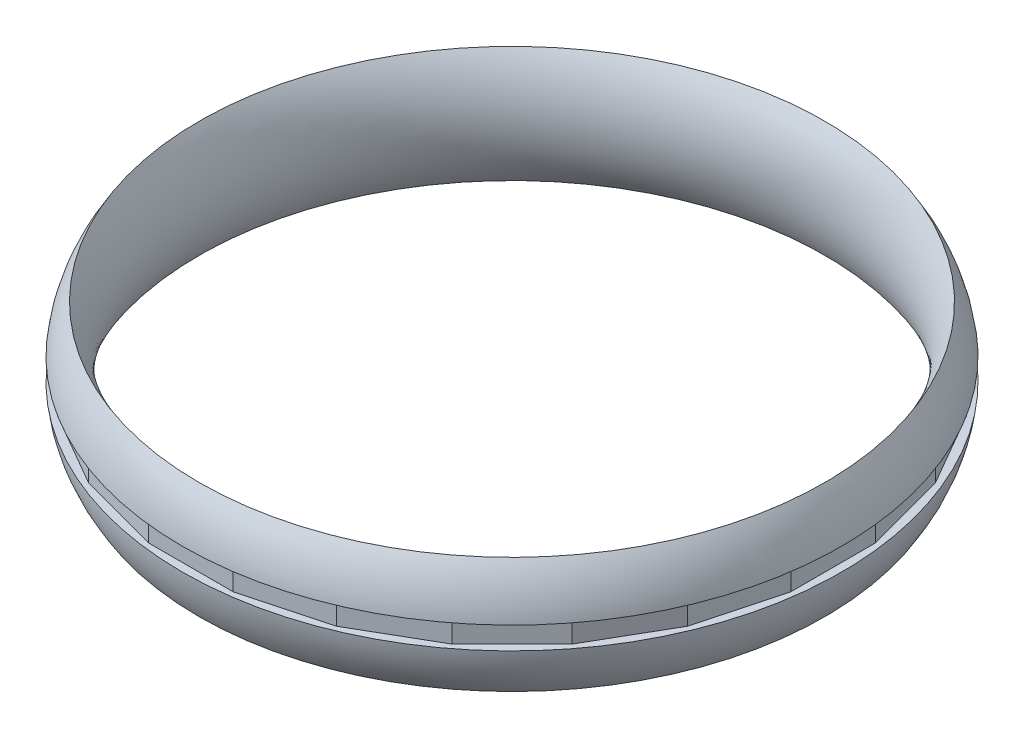
from build123d import *

# Parameters (mm, degrees)
SKETCH5_W          = 4
SKETCH5_H          = 5
CUT_EXTRUDE1_DEPTH = 106.250863209
CIRPATTERN1_START  = -2.5
CIRPATTERN1_DEPTH  = 5


# Read off the part's stored shape, not the designer's step: CirPattern1
with BuildPart() as part:
    # Sketch4 → Revolve1 (revolve)
    with BuildSketch(Plane(origin=(0, 0, 0), x_dir=(0, 0, -1), z_dir=(1, 0, 0))):
        with BuildLine():
            ThreePointArc((-70, -13), (-66.146279116, 0), (-70, 13))
            ThreePointArc((-70, 13), (-73.853720884, 0), (-70, -13))
        make_face()
    revolve(axis=Axis((0, 13, 0), (0, -1, 0)))

    # Sketch5 → Cut-Extrude1 (cut, symmetric)
    with BuildSketch(Plane.XY):
        with Locations((-73.853720884, 0)):
            Rectangle(SKETCH5_W, SKETCH5_H)
    extrude(amount=CUT_EXTRUDE1_DEPTH, both=True, mode=Mode.SUBTRACT)

    # CirPattern1 outline → CirPattern1 (cut)
    with BuildSketch(Plane(origin=(0, 0, 0), x_dir=(1, 0, 0), z_dir=(0, 1, 0)).offset(CIRPATTERN1_START)):
        Polygon((-57.497286734, -44.119219847), (-66.957008549, -27.734501037), (-71.853720884, -9.459721815), (-71.853720884, -75), (75, -75), (75, 75), (-71.853720884, 75), (-71.853720884, 9.459721815), (-66.957008549, 27.734501037), (-57.497286734, 44.119219847), (-44.119219847, 57.497286734), (-27.734501037, 66.957008549), (-9.459721815, 71.853720884), (9.459721815, 71.853720884), (27.734501037, 66.957008549), (44.119219847, 57.497286734), (57.497286734, 44.119219847), (66.957008549, 27.734501037), (71.853720884, 9.459721815), (71.853720884, -9.459721815), (66.957008549, -27.734501037), (57.497286734, -44.119219847), (44.119219847, -57.497286734), (27.734501037, -66.957008549), (9.459721815, -71.853720884), (-9.459721815, -71.853720884), (-27.734501037, -66.957008549), (-44.119219847, -57.497286734), align=None)
    extrude(amount=CIRPATTERN1_DEPTH, mode=Mode.SUBTRACT)


solid = part.part
